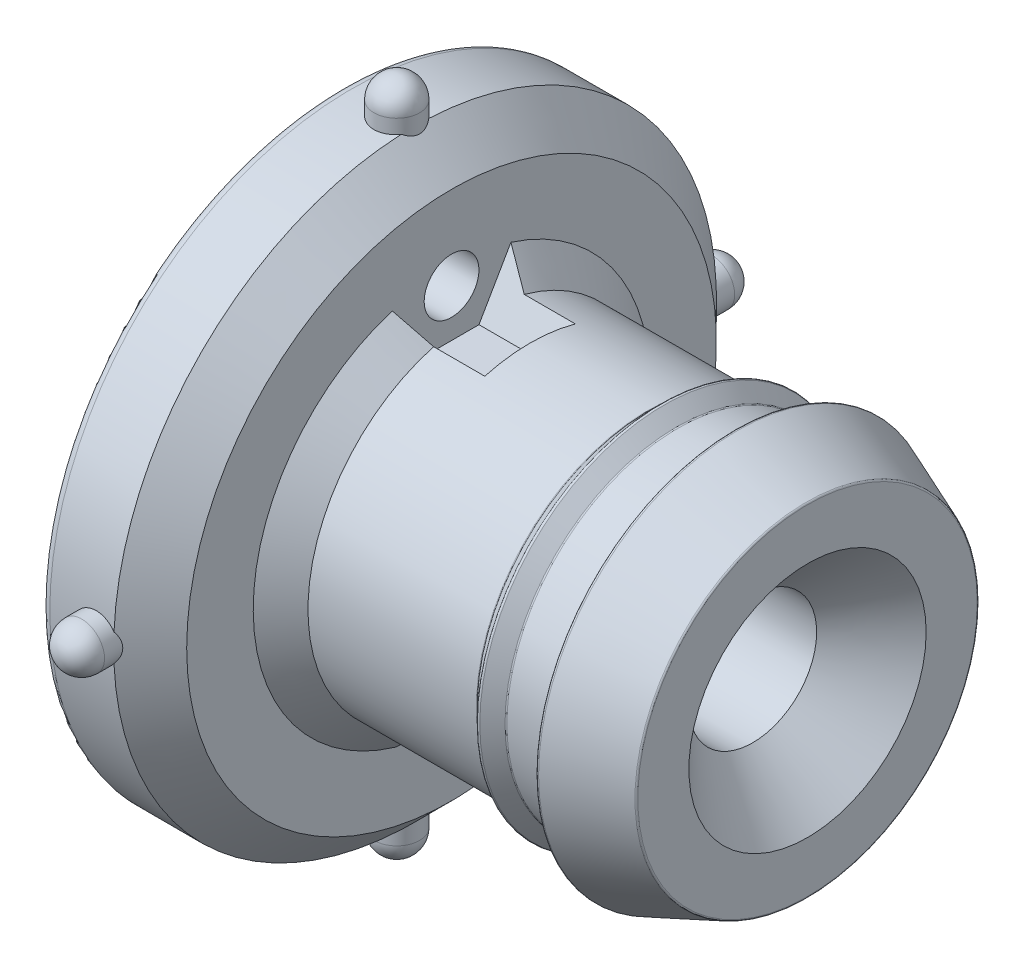
from build123d import *

# Parameters (mm, degrees)
SKETCH2_R            = 16.51
SKETCH2_R_2          = 3.5
BOSS_EXTRUDE1_DEPTH  = 1
SKETCH2_5_R          = 3.5
SKETCH2_5_W          = 2.46
SKETCH2_5_H          = 4.35
CUT_EXTRUDE1_DEPTH   = 31.42055555
BOSS_EXTRUDE4_START  = 1
SKETCH2_6_R          = 16.51
SKETCH2_6_W          = 18.58
SKETCH2_6_H          = 14.05
BOSS_EXTRUDE4_DEPTH  = 5
BOSS_EXTRUDE3_START  = 1
SKETCH2_4_R          = 0.9
BOSS_EXTRUDE3_DEPTH  = 5
FILLET1_R            = 0.1
FILLET4_R            = 0.5
CUT_SWEEP1_PROFILE_R = 0.9
SKETCH17_R           = 1.25
BOSS_EXTRUDE5_DEPTH  = 2
SKETCH17_3_R         = 1.25
BOSS_EXTRUDE6_DEPTH  = 0.5
FILLET6_R            = 1.25
CHAMFER1_SIZE        = 2
SKETCH18_W           = 3.5
SKETCH18_H           = 7.65
BOSS_EXTRUDE7_DEPTH  = 0.64
FILLET7_R            = 0.5
CHAMFER2_SIZE        = 2
SKETCH21_R           = 1.5
CUT_EXTRUDE2_DEPTH   = 10.3
CUT_EXTRUDE3_START   = -6
SKETCH21_4_R         = 1.5
CUT_EXTRUDE3_DEPTH   = 4.3
CHAMFER3_SIZE        = 3
FILLET8_R            = 1
CHAMFER4_SIZE        = 1.5
FILLET9_R            = 0.5


# Read off the part's stored shape, not the designer's step: CirPattern10
with BuildPart() as part:
    # Sketch1 → Revolve1 (revolve)
    with BuildSketch(Plane(origin=(0, 0, 0), x_dir=(1, 0, 0), z_dir=(0, 1, 0))):
        Polygon((0, 0), (-19.5, 0), (-19.5, 9.365), (-8.73, 9.365), (-7.94, 10.155), (-7.15, 9.365), (-3.97, 9.365), (-3.97, 10.955), (0, 9.365), align=None)
    revolve(axis=Axis((0, 0, 0), (-1, 0, 0)))

    # Sketch2 → Boss-Extrude1 (add)
    with BuildSketch(Plane.ZY.offset(19.5)):
        Circle(SKETCH2_R)
        Circle(SKETCH2_R_2, mode=Mode.SUBTRACT)
    extrude(amount=BOSS_EXTRUDE1_DEPTH)

    # Sketch2<5> → Cut-Extrude1 (cut, through all)
    # profile 1 of 2: a face of its own
    with BuildSketch(Plane.ZY.offset(19.5)):
        Circle(SKETCH2_5_R)
        with Locations((-0.31, 0.56)):
            Rectangle(SKETCH2_5_W, SKETCH2_5_H, mode=Mode.SUBTRACT)
    # profile 2 of 2: a face of its own
    with BuildSketch(Plane.ZY.offset(19.5)):
        with Locations((-0.31, 0.56)):
            Rectangle(SKETCH2_5_W, SKETCH2_5_H)
    extrude(amount=-CUT_EXTRUDE1_DEPTH, mode=Mode.SUBTRACT)

    # Sketch2<6> → Boss-Extrude4 (add)
    with BuildSketch(Plane.ZY.offset(19.5).offset(BOSS_EXTRUDE4_START)):
        Circle(SKETCH2_6_R)
        with Locations((0, -0.4)):
            Rectangle(SKETCH2_6_W, SKETCH2_6_H, mode=Mode.SUBTRACT)
    extrude(amount=BOSS_EXTRUDE4_DEPTH)

    # Sketch2<4> → Boss-Extrude3 (add)
    with BuildSketch(Plane.ZY.offset(19.5).offset(BOSS_EXTRUDE3_START)):
        with Locations(Location((6.19, 3.575, 0), (0, 0, 180))):
            Circle(SKETCH2_4_R)
        with Locations(Location((-6.19, 3.575, 0), (0, 0, 180))):
            Circle(SKETCH2_4_R)
    extrude(amount=BOSS_EXTRUDE3_DEPTH)

    # Fillet1
    fillet1_edges = [part.edges().sort_by_distance(p)[0] for p in [
        (-3.97, 0, 9.365),
        (-3.97, 0, 10.955),
        (0, 0, 9.365),
        (-8.73, 0, 9.365),
        (-7.94, 0, 10.155),
        (-7.15, 0, 9.365),
    ]]
    fillet(fillet1_edges, radius=FILLET1_R)

    # Fillet4
    fillet4_edges = [part.edges().sort_by_distance(p)[0] for p in [
        (-25.5, 3.575, 7.09),
        (-25.5, 3.575, -5.29),
    ]]
    fillet(fillet4_edges, radius=FILLET4_R)

    # Cut-Sweep1: sweep along a path in Sketch8
    with BuildLine(Plane.ZY.offset(25.5)) as cut_sweep1_path:
        CenterArc((0, 0), 14.14145, 0, 360)
    # Cut-Sweep1 profile (on start of the path) → Cut-Sweep1 (sweep, cut)
    with BuildSketch(Plane(origin=(-25.5, 0, 14.14145), x_dir=(0, 0, 1), z_dir=(0, 1, 0))):
        Circle(CUT_SWEEP1_PROFILE_R)
    sweep(path=cut_sweep1_path.line, mode=Mode.SUBTRACT)



with BuildPart() as body_2:
    # Sketch17 → Boss-Extrude5 (new body)
    with BuildSketch(Plane(origin=(0, -16.51, 0), x_dir=(-1, 0, 0), z_dir=(0, -1, 0))):
        with Locations(Location((22.5, 0, 0), (0, 0, 90))):
            Circle(SKETCH17_R)
    extrude(amount=BOSS_EXTRUDE5_DEPTH)


with BuildPart() as part_1:
    add(part.part)

    add(body_2.part)  # Boss-Extrude6 merges body 2
    # Sketch17<3> → Boss-Extrude6 (add)
    with BuildSketch(Plane(origin=(0, -16.51, 0), x_dir=(-1, 0, 0), z_dir=(0, -1, 0))):
        with Locations(Location((22.5, 0, 0), (0, 0, 90))):
            Circle(SKETCH17_3_R)
    extrude(amount=-BOSS_EXTRUDE6_DEPTH)

    # Fillet6
    fillet6_edges = [part_1.edges().sort_by_distance(p)[0] for p in [
        (-22.5, -18.51, 1.25),
    ]]
    fillet(fillet6_edges, radius=FILLET6_R)

    # CirPattern10 outline → CirPattern10 (revolve)
    with BuildSketch(Plane(origin=(-22.5, 0, 0), x_dir=(1, 0, 0), z_dir=(0, 0, 1))):
        with BuildLine():
            Line((0, 16.462586639), (1.25, 16.462586639))
            Line((1.25, 16.462586639), (1.25, 17.259999999))
            ThreePointArc((1.25, 17.259999999), (0.883883477, 18.143883476), (0, 18.51))
            Line((0, 18.51), (0, 16.462586639))
        make_face()
    revolve(axis=Axis((-22.5, 0, 0), (0, 1, 0)))

    # CirPattern10 2 outline → CirPattern10 2 (revolve)
    with BuildSketch(Plane(origin=(-22.5, 0, 0), x_dir=(1, 0, 0), z_dir=(0, -1, 0))):
        with BuildLine():
            Line((1.25, 16.462592789), (1.25, 17.259999999))
            ThreePointArc((1.25, 17.259999999), (0.883883477, 18.143883476), (0, 18.51))
            Line((0, 18.51), (0, 16.462592789))
            Line((0, 16.462592789), (1.25, 16.462592789))
        make_face()
        with BuildLine():
            Line((1.25, -17.259999999), (1.25, -16.462586639))
            Line((1.25, -16.462586639), (0, -16.462586639))
            Line((0, -16.462586639), (0, -18.51))
            ThreePointArc((0, -18.51), (0.883883477, -18.143883476), (1.25, -17.259999999))
        make_face()
    revolve(axis=Axis((-22.5, 0, 0), (0, 0, 1)))

    # Chamfer1
    # the kernel refuses this chamfer: 2 mm, written as the material it takes off along each edge
    with BuildSketch(Plane(origin=(-19.5, 0, 0), x_dir=(0, 0, 1), z_dir=(0, -1, 0))) as chamfer1_piece_1_section:
        Polygon((16.51, CHAMFER1_SIZE), (16.51 - CHAMFER1_SIZE, 0), (16.51, 0), align=None)
    chamfer1_piece_1 = revolve(axis=Axis((-19.5, 0, 0), (-1, 0, 0)), mode=Mode.PRIVATE)
    chamfer1_piece_1 = chamfer1_piece_1 - Plane(origin=(-22.5, 0, 0), x_dir=(0, 0, -1), z_dir=(0, -1, 0)) * Cylinder(1.25, 67, mode=Mode.PRIVATE)
    chamfer1_piece_1 = chamfer1_piece_1 - Plane(origin=(-22.5, 0, -15.552620412), x_dir=(1, 0, 0), z_dir=(0, 0, 1)) * Cylinder(1.25, 67, mode=Mode.PRIVATE)
    add(chamfer1_piece_1, mode=Mode.SUBTRACT)

    # Sketch18 → Boss-Extrude7 (add)
    with BuildSketch(Plane.ZY.offset(20.5)):
        with Locations((-7.54, -3.6)):
            Rectangle(SKETCH18_W, SKETCH18_H)
    extrude(amount=BOSS_EXTRUDE7_DEPTH)

    # Fillet7
    fillet7_edges = [part_1.edges().sort_by_distance(p)[0] for p in [
        (-21.14, -3.6, -5.79),
        (-21.14, 0.225, -7.54),
    ]]
    fillet(fillet7_edges, radius=FILLET7_R)

    # Chamfer2
    chamfer2_edges = [part_1.edges().sort_by_distance(p)[0] for p in [
        (-20.5, 0, -3.5),
    ]]
    chamfer(chamfer2_edges, length=CHAMFER2_SIZE)

    # Sketch21 → Cut-Extrude2 (cut)
    with BuildSketch(Plane.ZY.offset(25.5)):
        with Locations((0, -10.333225)):
            Circle(SKETCH21_R)
        with Locations((0, 9.933225)):
            Circle(SKETCH21_R)
    extrude(amount=-CUT_EXTRUDE2_DEPTH, mode=Mode.SUBTRACT)

    # Sketch21<4> → Cut-Extrude3 (cut)
    with BuildSketch(Plane.ZY.offset(25.5).offset(CUT_EXTRUDE3_START)):
        with Locations((0, 9.933225)):
            Circle(SKETCH21_4_R)
        Polygon((3.0022214, 9.933225), (-3.0022214, 9.933225), (-1.5011107, 12.533225), (1.5011107, 12.533225), align=None)
        Polygon((3.0022214, 9.933225), (-3.0022214, 9.933225), (-1.5011107, 7.333225), (1.5011107, 7.333225), align=None)
        with Locations((0, -10.333225)):
            Circle(SKETCH21_4_R)
        Polygon((-3.0022214, -10.333225), (3.0022214, -10.333225), (1.5011107, -7.733225), (-1.5011107, -7.733225), align=None)
        Polygon((-3.0022214, -10.333225), (3.0022214, -10.333225), (1.5011107, -12.933225), (-1.5011107, -12.933225), align=None)
    extrude(amount=-CUT_EXTRUDE3_DEPTH, mode=Mode.SUBTRACT)

    # Chamfer3
    chamfer3_edges = [part_1.edges().sort_by_distance(p)[0] for p in [
        (0, 0, -3.5),
    ]]
    chamfer(chamfer3_edges, length=CHAMFER3_SIZE)

    # Fillet8
    fillet8_edges = [part_1.edges().sort_by_distance(p)[0] for p in [
        (-25.5, 0, -13.24145),
    ]]
    fillet(fillet8_edges, radius=FILLET8_R)

    # Chamfer4
    chamfer4_edges = [part_1.edges().sort_by_distance(p)[0] for p in [
        (-19.5, -0.103660668, 9.364426275),
        (-19.5, -5.759631068, -7.38443464),
    ]]
    chamfer(chamfer4_edges, length=CHAMFER4_SIZE)

    # Fillet9
    fillet9_edges = [part_1.edges().sort_by_distance(p)[0] for p in [
        (-25.5, 0, -16.51),
    ]]
    fillet(fillet9_edges, radius=FILLET9_R)


solid = part_1.part
